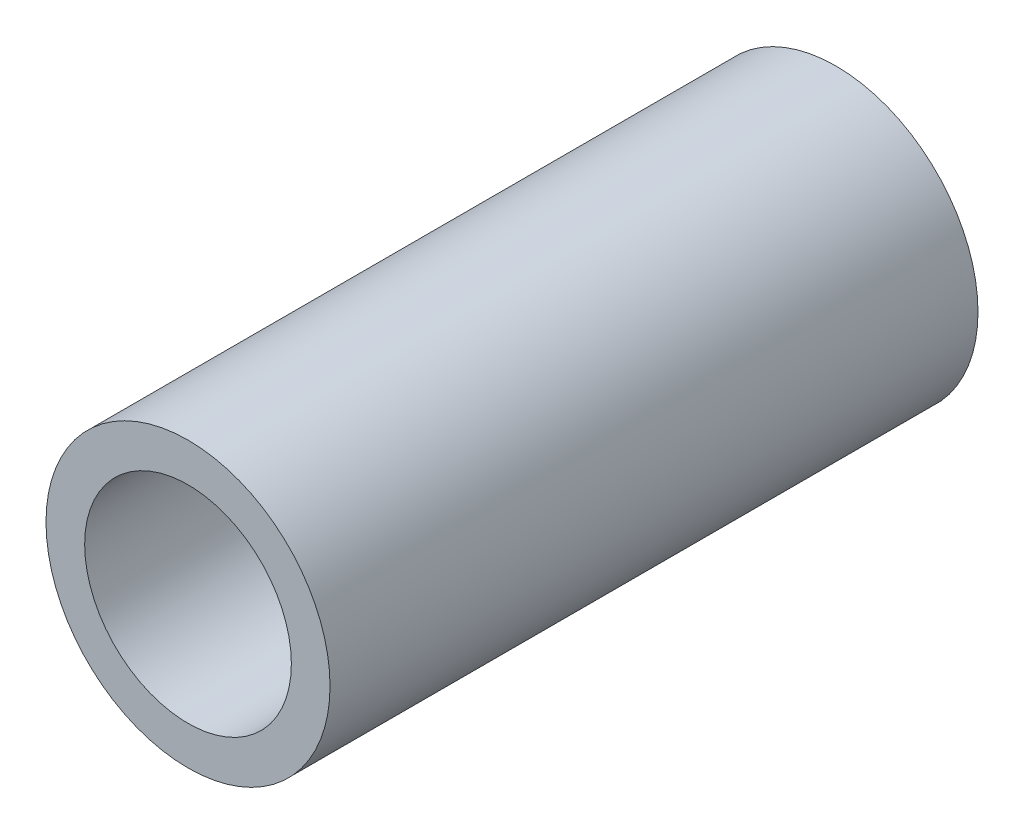
from build123d import *

# Parameters (mm, degrees)
SKETCH1_R           = 16.7005
SKETCH1_R_2         = 12.1539
EXTRUDE_THIN1_DEPTH = 76.2


with BuildPart() as part:
    # Sketch1 → Extrude-Thin1 (new body)
    with BuildSketch(Plane.XY):
        Circle(SKETCH1_R)
        Circle(SKETCH1_R_2, mode=Mode.SUBTRACT)
    extrude(amount=EXTRUDE_THIN1_DEPTH)


solid = part.part
